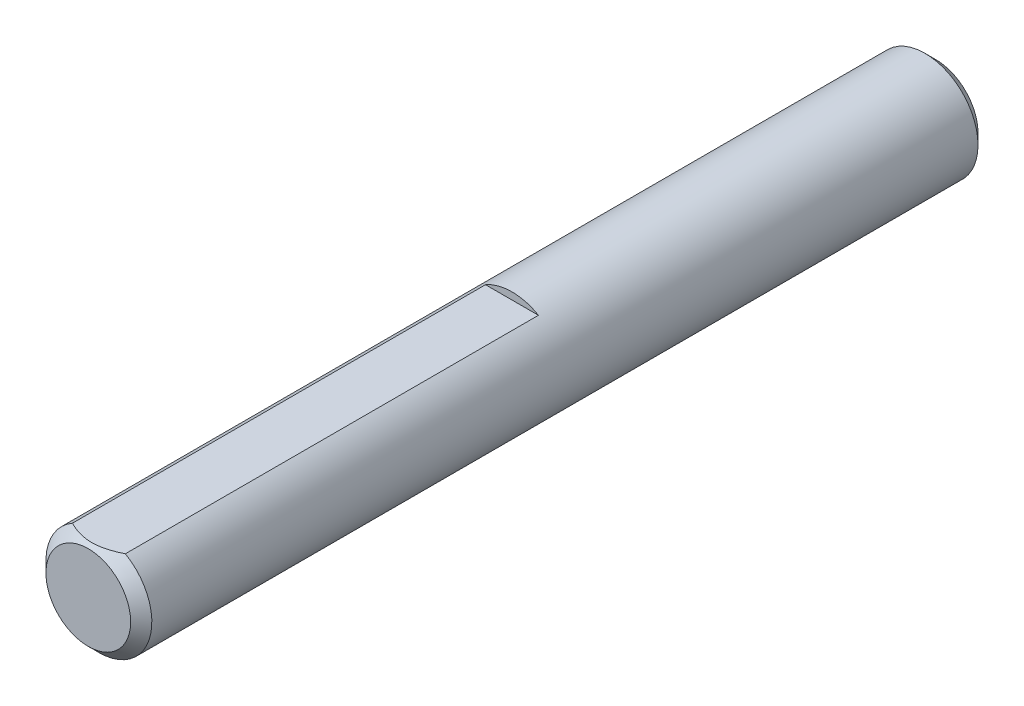
from build123d import *

# Parameters (mm, degrees)
SKETCH1_R      = 3.175
EXTRUDE1_DEPTH = 25.4
CHAMFER1_SIZE  = 0.635
EXTRUDE7_DEPTH = 26.793821935


with BuildPart() as part:
    # Sketch1 → Extrude1 (new, symmetric)
    with BuildSketch(Plane.XY):
        Circle(SKETCH1_R)
    extrude(amount=EXTRUDE1_DEPTH, both=True)

    # Chamfer1
    chamfer1_edges = [part.edges().sort_by_distance(p)[0] for p in [
        (-3.175, 0, -25.4),
        (-3.175, 0, 25.4),
    ]]
    chamfer(chamfer1_edges, length=CHAMFER1_SIZE)

    # Sketch13 → Extrude7 (cut, through all)
    with BuildSketch(Plane.XY):
        with BuildLine():
            Line((-1.5875, 2.749630657), (1.5875, 2.749630657))
            ThreePointArc((1.5875, 2.749630657), (0, 3.175), (-1.5875, 2.749630657))
        make_face()
    extrude(amount=EXTRUDE7_DEPTH, mode=Mode.SUBTRACT)


solid = part.part
